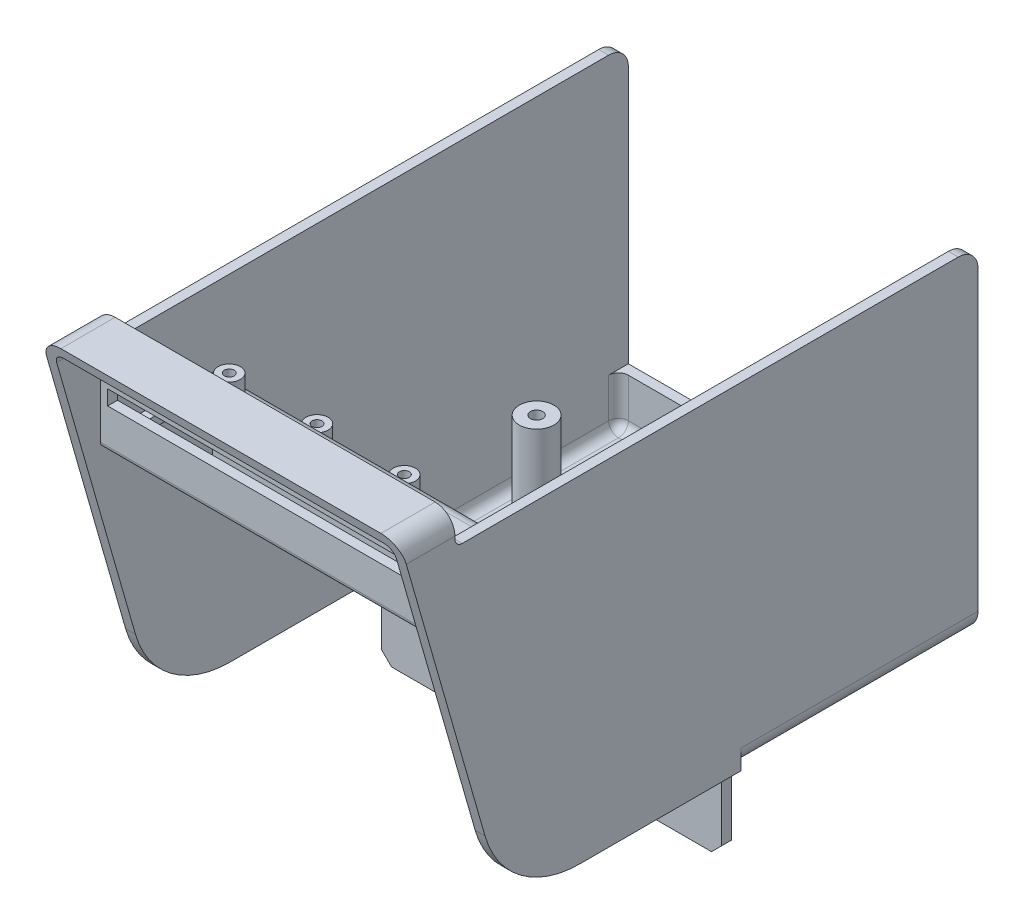
from build123d import *

# Parameters (mm, degrees)
BOSS_EXTRUDE1_DEPTH             = 66.66
BOSS_EXTRUDE1_DEPTH_BACK        = 7.5
SKETCH1_W                       = 72.85
SKETCH1_H                       = 108.98
CUT_EXTRUDE1_DEPTH              = 113.78226013
CUT_EXTRUDE1_DEPTH_BACK         = 113.78226013
FILLET1_R                       = 1
SHELL1_T                        = -2
CUT_EXTRUDE2_REACH              = 84.888
SKETCH3_W                       = 65
SKETCH3_H                       = 10
CUT_EXTRUDE3_REACH              = 79.417
SKETCH4_W                       = 65
SKETCH4_H                       = 10
CUT_EXTRUDE4_REACH              = 90.174
SKETCH5_W                       = 65
SKETCH5_H                       = 10
BOSS_EXTRUDE2_DEPTH             = 4.5
BOSS_EXTRUDE2_DEPTH_BACK        = 2
SKETCH7_R                       = 2.25
BOSS_EXTRUDE3_DEPTH             = 4.5
BOSS_EXTRUDE3_DEPTH_BACK        = 2
SKETCH8_R                       = 2.25
SKETCH9_R                       = 2.25
BOSS_EXTRUDE4_DEPTH             = 4.5
BOSS_EXTRUDE4_DIRECTION_2_REACH = 88.848
CUT_EXTRUDE5_REACH              = 134.842
SKETCH10_W                      = 66.016324661
SKETCH10_H                      = 3.018321317
SKETCH11_R                      = 3.5
BOSS_EXTRUDE5_DEPTH             = 19.72
BOSS_EXTRUDE6_DEPTH             = 2
SKETCH20_W                      = 68.85
SKETCH20_H                      = 10
BOSS_EXTRUDE7_DEPTH             = 2
CUT_EXTRUDE12_DEPTH             = 118.939129215
CUT_EXTRUDE6_REACH              = 106.811
SKETCH13_W                      = 68.85
SKETCH13_H                      = 2.5
FILLET4_R                       = 3
SKETCH14_W                      = 70.85
SKETCH14_H                      = 118.430630558
CUT_EXTRUDE7_DEPTH              = 1.5
CUT_EXTRUDE8_REACH              = 106.811
SKETCH16_R                      = 1.25
SKETCH17_R                      = 1
CUT_EXTRUDE9_DEPTH              = 4
SKETCH18_R                      = 1
CUT_EXTRUDE10_DEPTH             = 4
SKETCH19_R                      = 1
CUT_EXTRUDE11_DEPTH             = 4
SKETCH22_W                      = 107.98
SKETCH22_H                      = 6
CUT_EXTRUDE13_DEPTH             = 118.939129215
SKETCH23_W                      = 68.85
SKETCH23_H                      = 1
BOSS_EXTRUDE8_DEPTH             = 4
FILLET6_R                       = 2
FILLET7_R                       = 2
FILLET8_R                       = 4
SKETCH28_W                      = 68.85
SKETCH28_H                      = 2
BOSS_EXTRUDE10_DEPTH            = 15.2
CHAMFER2_SIZE                   = 2
SKETCH29_R                      = 1.75
CUT_EXTRUDE16_DEPTH             = 102.288381491
FILLET10_R                      = 2
CUT_EXTRUDE17_DEPTH             = 49.98
SKETCH31_W                      = 2.5
SKETCH31_H                      = 68.16
CUT_EXTRUDE18_DEPTH             = 89.83
BOSS_EXTRUDE11_START            = 0.52
BOSS_EXTRUDE11_DEPTH            = 0.52
SKETCH33_W                      = 68.85
SKETCH33_H                      = 2
BOSS_EXTRUDE12_DEPTH            = 10
FILLET11_R                      = 2
FILLET12_R                      = 4
FILLET13_R                      = 1.5


with BuildPart() as part:
    # Sketch1 → Boss-Extrude1 (new, two sides: drawn at the far end of the back side and taken through both)
    with BuildSketch(Plane(origin=(0, 0, 0), x_dir=(1, 0, 0), z_dir=(0, 1, 0)).offset(-BOSS_EXTRUDE1_DEPTH_BACK)):
        Rectangle(SKETCH1_W, SKETCH1_H)
    extrude(amount=BOSS_EXTRUDE1_DEPTH + BOSS_EXTRUDE1_DEPTH_BACK)

    # Sketch2 → Cut-Extrude1 (cut, two sides: drawn at the far end of the back side and taken through both)
    with BuildSketch(Plane(origin=(36.425, 0, 0), x_dir=(0, 0, -1), z_dir=(1, 0, 0)).offset(-CUT_EXTRUDE1_DEPTH_BACK)):
        Polygon((-54.49, 340.29873767), (-54.49, 66.66), (-54.49, 43.24), (-31.71, 43.24), (-31.71, 25.46), (-14.01, 25.46), (-14.01, 7.68), (2.51, 7.68), (2.51, -7.5), (2.51, -281.13873767), (-542.479756722, -331.126737051), (-599.479756722, 290.310738288), align=None)
    extrude(amount=CUT_EXTRUDE1_DEPTH + CUT_EXTRUDE1_DEPTH_BACK, mode=Mode.SUBTRACT)

    # Fillet1
    fillet1_edges = [part.edges().sort_by_distance(p)[0] for p in [
        (0, 43.24, 54.49),
        (0, 43.24, 31.71),
        (0, 25.46, 31.71),
        (0, 25.46, 14.01),
        (0, 7.68, 14.01),
        (0, 7.68, -2.51),
    ]]
    fillet(fillet1_edges, radius=FILLET1_R)

    # Shell1
    shell1_openings = [part.faces().sort_by_distance(p)[0] for p in [
        (0, 66.66, 0),
        (0, 29.58, -54.49),
    ]]
    offset(amount=SHELL1_T, openings=shell1_openings, kind=Kind.INTERSECTION)

    # Sketch3 → Cut-Extrude2 (cut, up to next)
    with BuildSketch(Plane.XZ.offset(-43.24), mode=Mode.PRIVATE) as cut_extrude2_sk1:
        with Locations((0, 42.39)):
            Rectangle(SKETCH3_W, SKETCH3_H)
    cut_extrude2_tool1 = extrude(cut_extrude2_sk1.sketch, amount=-CUT_EXTRUDE2_REACH, mode=Mode.PRIVATE) & part.part
    add(cut_extrude2_tool1.solids().sort_by_distance((0, 43.24, 42.39))[0], mode=Mode.SUBTRACT)

    # Sketch4 → Cut-Extrude3 (cut, up to next)
    with BuildSketch(Plane.XZ.offset(-25.46), mode=Mode.PRIVATE) as cut_extrude3_sk1:
        with Locations((0, 24.61)):
            Rectangle(SKETCH4_W, SKETCH4_H)
    cut_extrude3_tool1 = extrude(cut_extrude3_sk1.sketch, amount=-CUT_EXTRUDE3_REACH, mode=Mode.PRIVATE) & part.part
    add(cut_extrude3_tool1.solids().sort_by_distance((0, 25.46, 24.61))[0], mode=Mode.SUBTRACT)

    # Sketch5 → Cut-Extrude4 (cut, up to next)
    with BuildSketch(Plane.XZ.offset(-7.68), mode=Mode.PRIVATE) as cut_extrude4_sk1:
        with Locations((0, 6.91)):
            Rectangle(SKETCH5_W, SKETCH5_H)
    cut_extrude4_tool1 = extrude(cut_extrude4_sk1.sketch, amount=-CUT_EXTRUDE4_REACH, mode=Mode.PRIVATE) & part.part
    add(cut_extrude4_tool1.solids().sort_by_distance((0, 7.68, 6.91))[0], mode=Mode.SUBTRACT)

    # Sketch7 → Boss-Extrude2 (add, two sides: drawn at the far end of the back side and taken through both)
    with BuildSketch(Plane(origin=(0, 45.24, 0), x_dir=(1, 0, 0), z_dir=(0, 1, 0)).offset(-BOSS_EXTRUDE2_DEPTH_BACK)):
        with Locations(Location((-28, -34.79, 0), (0, 0, 112.415269488))):
            Circle(SKETCH7_R)
        with Locations(Location((28, -34.79, 0), (0, 0, 112.415269488))):
            Circle(SKETCH7_R)
    extrude(amount=BOSS_EXTRUDE2_DEPTH + BOSS_EXTRUDE2_DEPTH_BACK)

    # Sketch8 → Boss-Extrude3 (add, two sides: drawn at the far end of the back side and taken through both)
    with BuildSketch(Plane(origin=(0, 27.46, 0), x_dir=(1, 0, 0), z_dir=(0, 1, 0)).offset(-BOSS_EXTRUDE3_DEPTH_BACK)):
        with Locations(Location((-28, -17.01, 0), (0, 0, 270))):
            Circle(SKETCH8_R)
        with Locations(Location((28, -17.01, 0), (0, 0, 270))):
            Circle(SKETCH8_R)
    extrude(amount=BOSS_EXTRUDE3_DEPTH + BOSS_EXTRUDE3_DEPTH_BACK)

    # Sketch9 → Boss-Extrude4 (add)
    with BuildSketch(Plane(origin=(0, 9.68, 0), x_dir=(1, 0, 0), z_dir=(0, 1, 0))):
        with Locations(Location((-28, 0.69, 0), (0, 0, 270))):
            Circle(SKETCH9_R)
        with Locations(Location((28, 0.69, 0), (0, 0, 270))):
            Circle(SKETCH9_R)
    extrude(amount=BOSS_EXTRUDE4_DEPTH)

    # Sketch9 → Boss-Extrude4 direction 2 (add, up to next)
    with BuildSketch(Plane(origin=(0, 9.68, 0), x_dir=(1, 0, 0), z_dir=(0, 1, 0)), mode=Mode.PRIVATE) as boss_extrude4_direction_2_sk1:
        with Locations(Location((-28, 0.69, 0), (0, 0, 270))):
            Circle(SKETCH9_R)
    boss_extrude4_direction_2_tool1 = extrude(boss_extrude4_direction_2_sk1.sketch, amount=-BOSS_EXTRUDE4_DIRECTION_2_REACH, mode=Mode.PRIVATE) - part.part
    # Sketch9 → Boss-Extrude4 direction 2 (add, up to next)
    with BuildSketch(Plane(origin=(0, 9.68, 0), x_dir=(1, 0, 0), z_dir=(0, 1, 0)), mode=Mode.PRIVATE) as boss_extrude4_direction_2_sk2:
        with Locations(Location((28, 0.69, 0), (0, 0, 270))):
            Circle(SKETCH9_R)
    boss_extrude4_direction_2_tool2 = extrude(boss_extrude4_direction_2_sk2.sketch, amount=-BOSS_EXTRUDE4_DIRECTION_2_REACH, mode=Mode.PRIVATE) - part.part
    add(boss_extrude4_direction_2_tool1.solids().sort_by_distance((-28, 9.68, -0.69))[0])
    add(boss_extrude4_direction_2_tool2.solids().sort_by_distance((28, 9.68, -0.69))[0])

    # Sketch10 → Cut-Extrude5 (cut, up to next)
    with BuildSketch(Plane.XY.offset(54.49), mode=Mode.PRIVATE) as cut_extrude5_sk1:
        with Locations((0.072172778, 52.849160659)):
            Rectangle(SKETCH10_W, SKETCH10_H)
    cut_extrude5_tool1 = extrude(cut_extrude5_sk1.sketch, amount=-CUT_EXTRUDE5_REACH, mode=Mode.PRIVATE) & part.part
    add(cut_extrude5_tool1.solids().sort_by_distance((0.072173, 52.849161, 54.49))[0], mode=Mode.SUBTRACT)

    # Sketch11 → Boss-Extrude5 (add)
    with BuildSketch(Plane(origin=(0, -5.5, 0), x_dir=(1, 0, 0), z_dir=(0, 1, 0))):
        with Locations(Location((-25, 24.49, 0), (0, 0, 90))):
            Circle(SKETCH11_R)
        with Locations(Location((25, 24.49, 0), (0, 0, 90))):
            Circle(SKETCH11_R)
    extrude(amount=BOSS_EXTRUDE5_DEPTH)

    # Sketch12 → Boss-Extrude6 (add)
    with BuildSketch(Plane.ZY.offset(36.425)):
        with BuildLine():
            Line((54.49, 66.66), (64.49, 66.66))
            Line((64.49, 66.66), (47.379115109, 6.987252884))
            ThreePointArc((47.379115109, 6.987252884), (40.190181653, -3.472710201), (28.15388119, -7.5))
            Line((28.15388119, -7.5), (-54.49, -7.5))
            Line((-54.49, -7.5), (54.49, 66.66))
        make_face()
    boss_extrude6 = extrude(amount=-BOSS_EXTRUDE6_DEPTH)

    # Mirror1: Boss-Extrude6 across plane
    add(boss_extrude6.mirror(Plane(origin=(0, 0, 0), x_dir=(0, 0, 1), z_dir=(1, 0, 0))))

    # Sketch20 → Boss-Extrude7 (add)
    with BuildSketch(Plane(origin=(0, 66.66, 0), x_dir=(1, 0, 0), z_dir=(0, 1, 0))):
        with Locations((0, -59.49)):
            Rectangle(SKETCH20_W, SKETCH20_H)
    extrude(amount=-BOSS_EXTRUDE7_DEPTH)

    # Sketch21 → Cut-Extrude12 (cut, through all)
    with BuildSketch(Plane(origin=(36.425, 0, 0), x_dir=(0, 0, -1), z_dir=(1, 0, 0))):
        Polygon((-64.49, 66.66), (-63.712511028, 63.948573728), (-66.437180196, 63.948573728), align=None)
    extrude(amount=-CUT_EXTRUDE12_DEPTH, mode=Mode.SUBTRACT)

    # Sketch13 → Cut-Extrude6 (cut, up to next)
    with BuildSketch(Plane.XZ.offset(7.5), mode=Mode.PRIVATE) as cut_extrude6_sk1:
        with Locations((0, -53.24)):
            Rectangle(SKETCH13_W, SKETCH13_H)
    cut_extrude6_tool1 = extrude(cut_extrude6_sk1.sketch, amount=-CUT_EXTRUDE6_REACH, mode=Mode.PRIVATE) & part.part
    add(cut_extrude6_tool1.solids().sort_by_distance((0, -7.5, -53.24))[0], mode=Mode.SUBTRACT)

    # Fillet4
    fillet4_edges = [part.edges().sort_by_distance(p)[0] for p in [
        (35.425, 66.66, -54.49),
        (-35.425, 66.66, -54.49),
    ]]
    fillet(fillet4_edges, radius=FILLET4_R)

    # Sketch14 → Cut-Extrude7 (cut)
    with BuildSketch(Plane(origin=(0, 66.66, 0), x_dir=(1, 0, 0), z_dir=(0, 1, 0))):
        with Locations((0, 5.725315279)):
            Rectangle(SKETCH14_W, SKETCH14_H)
    extrude(amount=-CUT_EXTRUDE7_DEPTH, mode=Mode.SUBTRACT)

    # Sketch16 → Cut-Extrude8 (cut, up to next)
    with BuildSketch(Plane.XZ.offset(7.5), mode=Mode.PRIVATE) as cut_extrude8_sk1:
        with Locations(Location((-25, -24.49, 0), (0, 0, 270))):
            Circle(SKETCH16_R)
    cut_extrude8_tool1 = extrude(cut_extrude8_sk1.sketch, amount=-CUT_EXTRUDE8_REACH, mode=Mode.PRIVATE) & part.part
    # Sketch16 → Cut-Extrude8 (cut, up to next)
    with BuildSketch(Plane.XZ.offset(7.5), mode=Mode.PRIVATE) as cut_extrude8_sk2:
        with Locations(Location((25, -24.49, 0), (0, 0, 270))):
            Circle(SKETCH16_R)
    cut_extrude8_tool2 = extrude(cut_extrude8_sk2.sketch, amount=-CUT_EXTRUDE8_REACH, mode=Mode.PRIVATE) & part.part
    add(cut_extrude8_tool1.solids().sort_by_distance((-25, -7.5, -24.49))[0], mode=Mode.SUBTRACT)
    add(cut_extrude8_tool2.solids().sort_by_distance((25, -7.5, -24.49))[0], mode=Mode.SUBTRACT)

    # Sketch17 → Cut-Extrude9 (cut)
    with BuildSketch(Plane(origin=(0, 14.18, 0), x_dir=(1, 0, 0), z_dir=(0, 1, 0))):
        with Locations(Location((-28, 0.69, 0), (0, 0, 270))):
            Circle(SKETCH17_R)
        with Locations(Location((28, 0.69, 0), (0, 0, 270))):
            Circle(SKETCH17_R)
    extrude(amount=-CUT_EXTRUDE9_DEPTH, mode=Mode.SUBTRACT)

    # Sketch18 → Cut-Extrude10 (cut)
    with BuildSketch(Plane(origin=(0, 31.96, 0), x_dir=(1, 0, 0), z_dir=(0, 1, 0))):
        with Locations(Location((-28, -17.01, 0), (0, 0, 270))):
            Circle(SKETCH18_R)
        with Locations(Location((28, -17.01, 0), (0, 0, 270))):
            Circle(SKETCH18_R)
    extrude(amount=-CUT_EXTRUDE10_DEPTH, mode=Mode.SUBTRACT)

    # Sketch19 → Cut-Extrude11 (cut)
    with BuildSketch(Plane(origin=(0, 49.74, 0), x_dir=(1, 0, 0), z_dir=(0, 1, 0))):
        with Locations(Location((-28, -34.79, 0), (0, 0, 270))):
            Circle(SKETCH19_R)
        with Locations(Location((28, -34.79, 0), (0, 0, 270))):
            Circle(SKETCH19_R)
    extrude(amount=-CUT_EXTRUDE11_DEPTH, mode=Mode.SUBTRACT)

    # Sketch22 → Cut-Extrude13 (cut, through all)
    with BuildSketch(Plane(origin=(36.425, 0, 0), x_dir=(0, 0, -1), z_dir=(1, 0, 0))):
        with Locations((0.5, 63.66)):
            Rectangle(SKETCH22_W, SKETCH22_H)
    extrude(amount=-CUT_EXTRUDE13_DEPTH, mode=Mode.SUBTRACT)

    # Sketch23 → Boss-Extrude8 (add)
    with BuildSketch(Plane(origin=(0, 60.66, 0), x_dir=(1, 0, 0), z_dir=(0, 1, 0))):
        with Locations((0, -52.99)):
            Rectangle(SKETCH23_W, SKETCH23_H)
    extrude(amount=BOSS_EXTRUDE8_DEPTH)

    # Fillet6
    fillet6_edges = [part.edges().sort_by_distance(p)[0] for p in [
        (34.425, 64.66, 52.99),
        (-34.425, 64.66, 52.99),
    ]]
    fillet(fillet6_edges, radius=FILLET6_R)

    # Fillet7
    fillet7_edges = [part.edges().sort_by_distance(p)[0] for p in [
        (34.425, 64.66, 59.203254614),
        (-34.425, 64.66, 59.203254614),
    ]]
    fillet(fillet7_edges, radius=FILLET7_R)

    # Fillet8
    fillet8_edges = [part.edges().sort_by_distance(p)[0] for p in [
        (36.425, 66.66, 58.99),
        (-36.425, 66.66, 58.99),
    ]]
    fillet(fillet8_edges, radius=FILLET8_R)

    # Sketch28 → Boss-Extrude10 (add)
    with BuildSketch(Plane.XZ.offset(7.5)):
        with Locations((0, -3.51)):
            Rectangle(SKETCH28_W, SKETCH28_H)
    extrude(amount=BOSS_EXTRUDE10_DEPTH)

    # Chamfer2
    chamfer2_edges = [part.edges().sort_by_distance(p)[0] for p in [
        (-34.425, -22.7, -3.51),
        (34.425, -22.7, -3.51),
    ]]
    chamfer(chamfer2_edges, length=CHAMFER2_SIZE)

    # Sketch29 → Cut-Extrude16 (cut, through all)
    with BuildSketch(Plane.XY.offset(-2.51)):
        with Locations((-24.425, -14.7)):
            Circle(SKETCH29_R)
        with Locations((24.425, -14.7)):
            Circle(SKETCH29_R)
    extrude(amount=-CUT_EXTRUDE16_DEPTH, mode=Mode.SUBTRACT)

    # Fillet10
    fillet10_edges = [part.edges().sort_by_distance(p)[0] for p in [
        (-34.425, -5.5, -28.25),
        (34.425, -5.5, -28.25),
    ]]
    fillet(fillet10_edges, radius=FILLET10_R)

    # Sketch30 → Cut-Extrude17 (cut)
    with BuildSketch(Plane(origin=(0, 0, -54.49), x_dir=(-1, 0, 0), z_dir=(0, 0, -1))):
        with BuildLine():
            Line((-36.425, -3.5), (-36.425, -7.5))
            Line((-36.425, -7.5), (-32.425, -7.5))
            ThreePointArc((-32.425, -7.5), (-35.253427125, -6.328427125), (-36.425, -3.5))
        make_face()
        with BuildLine():
            Line((36.425, -7.5), (32.425, -7.5))
            ThreePointArc((32.425, -7.5), (35.253427125, -6.328427125), (36.425, -3.5))
            Line((36.425, -3.5), (36.425, -7.5))
        make_face()
    extrude(amount=-CUT_EXTRUDE17_DEPTH, mode=Mode.SUBTRACT)

    # Sketch31 → Cut-Extrude18 (cut, symmetric)
    with BuildSketch(Plane.ZY):
        with Locations((-53.24, 26.58)):
            Rectangle(SKETCH31_W, SKETCH31_H)
    extrude(amount=CUT_EXTRUDE18_DEPTH, both=True, mode=Mode.SUBTRACT)

    # Sketch32 → Boss-Extrude11 (add)
    with BuildSketch(Plane(origin=(0, 0, -51.99), x_dir=(-1, 0, 0), z_dir=(0, 0, -1)).offset(BOSS_EXTRUDE11_START)):
        with BuildLine():
            Line((-34.425, -3.5), (-34.425, 60.66))
            Line((-34.425, 60.66), (-36.425, 60.66))
            Line((-36.425, 60.66), (-36.425, -3.5))
            ThreePointArc((-36.425, -3.5), (-35.253427125, -6.328427125), (-32.425, -7.5))
            Line((-32.425, -7.5), (32.425, -7.5))
            ThreePointArc((32.425, -7.5), (35.253427125, -6.328427125), (36.425, -3.5))
            Line((36.425, -3.5), (36.425, 60.66))
            Line((36.425, 60.66), (34.425, 60.66))
            Line((34.425, 60.66), (34.425, -3.5))
            ThreePointArc((34.425, -3.5), (33.839213562, -4.914213562), (32.425, -5.5))
            Line((32.425, -5.5), (-32.425, -5.5))
            ThreePointArc((-32.425, -5.5), (-33.839213562, -4.914213562), (-34.425, -3.5))
        make_face()
    extrude(amount=-BOSS_EXTRUDE11_DEPTH)

    # Sketch33 → Boss-Extrude12 (add)
    with BuildSketch(Plane(origin=(0, -5.5, 0), x_dir=(1, 0, 0), z_dir=(0, 1, 0))):
        with Locations((0, 51.51)):
            Rectangle(SKETCH33_W, SKETCH33_H)
    extrude(amount=BOSS_EXTRUDE12_DEPTH)

    # Fillet11
    fillet11_edges = [part.edges().sort_by_distance(p)[0] for p in [
        (33.839213562, -4.914213562, -50.51),
        (-34.425, 0.5, -50.51),
        (-33.839213562, -4.914213562, -50.51),
        (0, -5.5, -50.51),
        (34.425, 0.5, -50.51),
    ]]
    fillet(fillet11_edges, radius=FILLET11_R)

    # Fillet12
    fillet12_edges = [part.edges().sort_by_distance(p)[0] for p in [
        (35.425, 60.66, -52.51),
        (-35.425, 60.66, -52.51),
    ]]
    fillet(fillet12_edges, radius=FILLET12_R)

    # Fillet13
    # the kernel refuses this fillet: 1.5 mm, written as the material it adds along each edge
    with BuildSketch(Plane(origin=(-34.425, 60.66, 53.49), x_dir=(0, 0, -1), z_dir=(-1, 0, 0))) as fillet13_piece_1:
        with BuildLine():
            CenterArc((FILLET13_R, -FILLET13_R), FILLET13_R, 90, 90)
            Line((0, -FILLET13_R), (0, 0))
            Line((0, 0), (FILLET13_R, 0))
        make_face()
    extrude(amount=2)
    with BuildSketch(Plane(origin=(36.425, 60.66, 53.49), x_dir=(0, 1, 0), z_dir=(-1, 0, 0))) as fillet13_piece_2:
        with BuildLine():
            CenterArc((FILLET13_R, FILLET13_R), FILLET13_R, 180, 90)
            Line((0, FILLET13_R), (0, 0))
            Line((0, 0), (FILLET13_R, 0))
        make_face()
    extrude(amount=2)


solid = part.part
